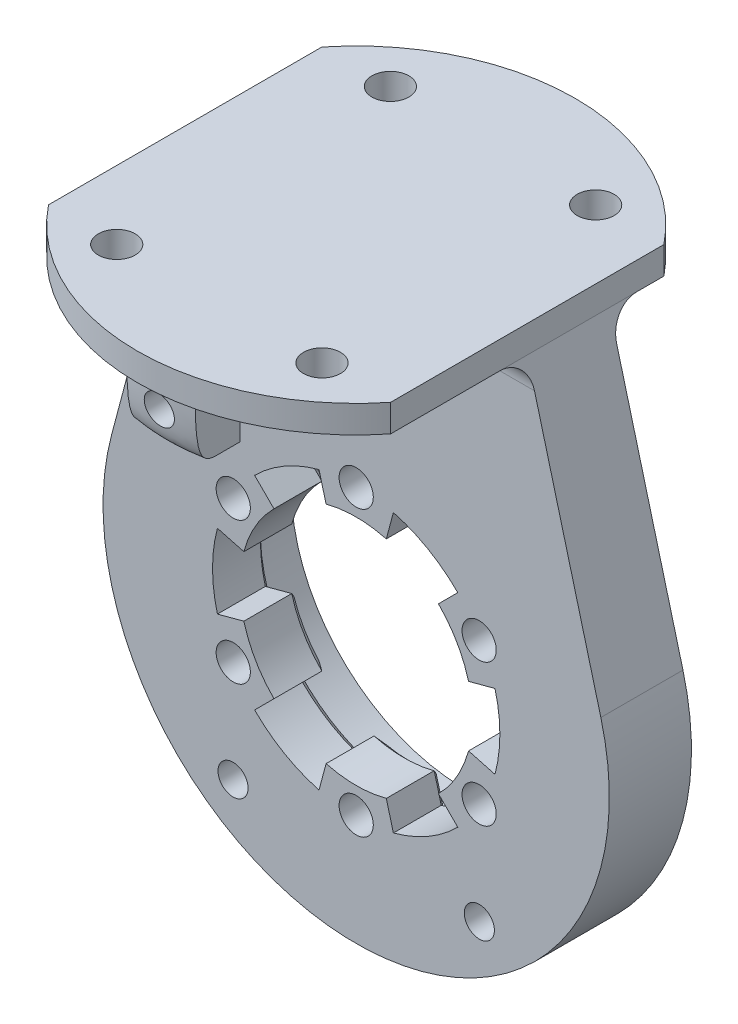
from build123d import *

# Parameters (mm, degrees)
EXTRUDE_1_DEPTH     = 6
SKETCH_4_R          = 12.75
CUT_EXTRUDE_2_DEPTH = 2
SKETCH_5_R          = 8.5
CUT_EXTRUDE_3_DEPTH = 32.356817441
EXTRUDE_START       = 2
SKETCH_6_R          = 13.75
SKETCH_6_R_2        = 12.75
EXTRUDE_2_DEPTH     = 2
CUT_EXTRUDE_4_DEPTH = 32.356817441
CHAMFER_1_SIZE      = 0.5
DRAFT_1_ANGLE       = 67
SKETCH_8_R          = 1.25
CUT_EXTRUDE_5_DEPTH = 33.113081447
EXTRUDE_3_DEPTH     = 2
FILLET_1_R          = 2
SKETCH_11_R         = 1.35
CUT_EXTRUDE_6_DEPTH = 54.819141576
EXTRUDE_4_DEPTH     = 5
SKETCH_13_R         = 1.1
CUT_EXTRUDE_7_DEPTH = 5
SKETCH_14_R         = 1.1
CUT_EXTRUDE_8_DEPTH = 37.431442464
FILLET_2_SIZE       = 5
FILLET_2_SIZE_2     = 1.5


with BuildPart() as part:
    # 스케치1 → 보스-돌출1 (new body)
    with BuildSketch(Plane.XY):
        with BuildLine():
            Line((-12.5, 25), (12.5, 25))
            Line((12.5, 25), (17.879777489, 4.750111255))
            ThreePointArc((17.879777489, 4.750111255), (0, -18.5), (-17.879777489, 4.750111255))
            Line((-17.879777489, 4.750111255), (-12.5, 25))
        make_face()
    extrude(amount=EXTRUDE_1_DEPTH)

    # 스케치4 → 컷-돌출2 (cut)
    with BuildSketch(Plane(origin=(0, 0, 0), x_dir=(-1, 0, 0), z_dir=(0, 0, -1))):
        Circle(SKETCH_4_R)
    extrude(amount=-CUT_EXTRUDE_2_DEPTH, mode=Mode.SUBTRACT)

    # 스케치5 → 컷-돌출3 (cut, through all)
    with BuildSketch(Plane(origin=(0, 0, 2), x_dir=(-1, 0, 0), z_dir=(0, 0, -1))):
        Circle(SKETCH_5_R)
    extrude(amount=-CUT_EXTRUDE_3_DEPTH, mode=Mode.SUBTRACT)

    # 스케치6 → 보스-돌출2 (add)
    with BuildSketch(Plane(origin=(0, 0, 0), x_dir=(-1, 0, 0), z_dir=(0, 0, -1)).offset(EXTRUDE_START)):
        with Locations(Location((0, 0, 0), (0, 0, 180))):
            Circle(SKETCH_6_R)
        Circle(SKETCH_6_R_2, mode=Mode.SUBTRACT)
    extrude(amount=-EXTRUDE_2_DEPTH)

    # 스케치7 → 컷-돌출4 (cut, through all)
    with BuildSketch(Plane(origin=(0, 0, 2), x_dir=(-1, 0, 0), z_dir=(0, 0, -1))):
        with BuildLine():
            Line((2.199961883, 8.210369523), (2.717599974, 10.142221176))
            ThreePointArc((2.717599974, 10.142221176), (5.25, 9.09326674), (7.424621202, 7.424621202))
            Line((7.424621202, 7.424621202), (6.01040764, 6.01040764))
            ThreePointArc((6.01040764, 6.01040764), (4.25, 7.361215932), (2.199961883, 8.210369523))
        make_face()
        with BuildLine():
            Line((8.210369523, 2.199961883), (10.142221176, 2.717599974))
            ThreePointArc((10.142221176, 2.717599974), (10.5, 0), (10.142221176, -2.717599974))
            Line((10.142221176, -2.717599974), (8.210369523, -2.199961883))
            ThreePointArc((8.210369523, -2.199961883), (8.5, 0), (8.210369523, 2.199961883))
        make_face()
        with BuildLine():
            Line((6.01040764, -6.01040764), (7.424621202, -7.424621202))
            ThreePointArc((7.424621202, -7.424621202), (5.25, -9.09326674), (2.717599974, -10.142221176))
            Line((2.717599974, -10.142221176), (2.199961883, -8.210369523))
            ThreePointArc((2.199961883, -8.210369523), (4.25, -7.361215932), (6.01040764, -6.01040764))
        make_face()
        with BuildLine():
            Line((-2.199961883, -8.210369523), (-2.717599974, -10.142221176))
            ThreePointArc((-2.717599974, -10.142221176), (-5.25, -9.09326674), (-7.424621202, -7.424621202))
            Line((-7.424621202, -7.424621202), (-6.01040764, -6.01040764))
            ThreePointArc((-6.01040764, -6.01040764), (-4.25, -7.361215932), (-2.199961883, -8.210369523))
        make_face()
        with BuildLine():
            Line((-8.210369523, -2.199961883), (-10.142221176, -2.717599974))
            ThreePointArc((-10.142221176, -2.717599974), (-10.5, 0), (-10.142221176, 2.717599974))
            Line((-10.142221176, 2.717599974), (-8.210369523, 2.199961883))
            ThreePointArc((-8.210369523, 2.199961883), (-8.5, 0), (-8.210369523, -2.199961883))
        make_face()
        with BuildLine():
            Line((-6.01040764, 6.01040764), (-7.424621202, 7.424621202))
            ThreePointArc((-7.424621202, 7.424621202), (-5.25, 9.09326674), (-2.717599974, 10.142221176))
            Line((-2.717599974, 10.142221176), (-2.199961883, 8.210369523))
            ThreePointArc((-2.199961883, 8.210369523), (-4.25, 7.361215932), (-6.01040764, 6.01040764))
        make_face()
    extrude(amount=-CUT_EXTRUDE_4_DEPTH, mode=Mode.SUBTRACT)

    # 모따기1
    chamfer_1_edges = [part.edges().sort_by_distance(p)[0] for p in [
        (-7.361215932, 4.25, 2),
        (0, 8.5, 2),
        (7.361215932, 4.25, 2),
        (7.361215932, -4.25, 2),
        (0, -8.5, 2),
        (-7.361215932, -4.25, 2),
        (2.458780928, 9.17629535, 2),
        (5.25, 9.09326674, 2),
        (6.717514421, 6.717514421, 2),
        (9.17629535, 2.458780928, 2),
        (10.5, 0, 2),
        (9.17629535, -2.458780928, 2),
        (6.717514421, -6.717514421, 2),
        (5.25, -9.09326674, 2),
        (2.458780928, -9.17629535, 2),
        (-2.458780928, -9.17629535, 2),
        (-5.25, -9.09326674, 2),
        (-6.717514421, -6.717514421, 2),
        (-9.17629535, -2.458780928, 2),
        (-10.5, 0, 2),
        (-9.17629535, 2.458780928, 2),
        (-5.25, 9.09326674, 2),
        (-2.458780928, 9.17629535, 2),
        (-6.717514421, 6.717514421, 2),
    ]]
    chamfer(chamfer_1_edges, length=CHAMFER_1_SIZE)

    # 구배1
    draft_1_faces = [part.faces().sort_by_distance(p)[0] for p in [
        (-13.75, 0, -1),
    ]]
    draft(draft_1_faces, Plane(origin=(0, 0, -2), x_dir=(-1, 0, 0), z_dir=(0, 0, -1)), DRAFT_1_ANGLE)

    # 스케치8 → 컷-돌출5 (cut, through all)
    with BuildSketch(Plane.XY.offset(6)):
        with Locations((0, 10.375)):
            Circle(SKETCH_8_R)
        with Locations((8.985013564, 5.1875)):
            Circle(SKETCH_8_R)
        with Locations((8.985013564, -5.1875)):
            Circle(SKETCH_8_R)
        with Locations((0, -10.375)):
            Circle(SKETCH_8_R)
        with Locations((-8.985013564, -5.1875)):
            Circle(SKETCH_8_R)
        with Locations((-8.985013564, 5.1875)):
            Circle(SKETCH_8_R)
    extrude(amount=-CUT_EXTRUDE_5_DEPTH, mode=Mode.SUBTRACT)

    # 스케치9 → 보스-돌출3 (add)
    with BuildSketch(Plane(origin=(0, 25, 0), x_dir=(1, 0, 0), z_dir=(0, 1, 0))):
        with BuildLine():
            Line((-12.5, 3.987492178), (-12.5, -15.987492178))
            ThreePointArc((-12.5, -15.987492178), (0, -22), (12.5, -15.987492178))
            Line((12.5, -15.987492178), (12.5, 3.987492178))
            ThreePointArc((12.5, 3.987492178), (0, 10), (-12.5, 3.987492178))
        make_face()
    extrude(amount=EXTRUDE_3_DEPTH)

    # 필렛1
    fillet_1_edges = [part.edges().sort_by_distance(p)[0] for p in [
        (0, 25, 6),
        (0, 25, 0),
    ]]
    fillet(fillet_1_edges, radius=FILLET_1_R)

    # 스케치11 → 컷-돌출6 (cut, through all)
    with BuildSketch(Plane(origin=(0, 27, 0), x_dir=(1, 0, 0), z_dir=(0, 1, 0))):
        with Locations(Location((-7.5, 4, 0), (0, 0, 180))):
            Circle(SKETCH_11_R)
        with Locations(Location((7.5, 4, 0), (0, 0, 180))):
            Circle(SKETCH_11_R)
        with Locations(Location((-7.5, -16, 0), (0, 0, 180))):
            Circle(SKETCH_11_R)
        with Locations(Location((7.5, -16, 0), (0, 0, 180))):
            Circle(SKETCH_11_R)
    extrude(amount=-CUT_EXTRUDE_6_DEPTH, mode=Mode.SUBTRACT)

    # 스케치12 → 보스-돌출4 (add)
    with BuildSketch(Plane.XZ.offset(-25)):
        with BuildLine():
            Line((-2.5, 20.282856857), (-2.5, 17))
            Line((-2.5, 17), (2.5, 17))
            Line((2.5, 17), (2.5, 20.282856857))
            ThreePointArc((2.5, 20.282856857), (0, 20.5), (-2.5, 20.282856857))
        make_face()
    extrude(amount=EXTRUDE_4_DEPTH)

    # 스케치13 → 컷-돌출7 (cut)
    with BuildSketch(Plane(origin=(0, 0, 17), x_dir=(-1, 0, 0), z_dir=(0, 0, -1))):
        with Locations((0, 22.5)):
            Circle(SKETCH_13_R)
    extrude(amount=-CUT_EXTRUDE_7_DEPTH, mode=Mode.SUBTRACT)

    # 스케치14 → 컷-돌출8 (cut, through all)
    with BuildSketch(Plane.XY.offset(6)):
        with Locations((-9, -12.619429464)):
            Circle(SKETCH_14_R)
        with Locations((9, -12.619429464)):
            Circle(SKETCH_14_R)
    extrude(amount=-CUT_EXTRUDE_8_DEPTH, mode=Mode.SUBTRACT)

    # 필렛2
    # a fillet whose section is not a circle: 5, 1.5 mm, written as the material it takes off along each edge
    with BuildSketch(Plane(origin=(0, 20, 6), x_dir=(0.8600488727664471, 1.2250736823450093e-15, 0.5102116584841666), z_dir=(0.5102116584841666, 0, -0.8600488727664471))) as fillet_2_piece_1:
        with BuildLine():
            Bezier((14.5, -FILLET_2_SIZE), (14.5, 0), (14.5 - FILLET_2_SIZE_2, 0), weights=[1, 1.5, 1])
            Line((14.5 - FILLET_2_SIZE_2, 0), (14.5, 0))
            Line((14.5, 0), (14.5, -FILLET_2_SIZE))
        make_face()
    revolve(axis=Axis((0, 20, 6), (0, -1, 0)), revolution_arc=118.64414153, mode=Mode.SUBTRACT)


solid = part.part
